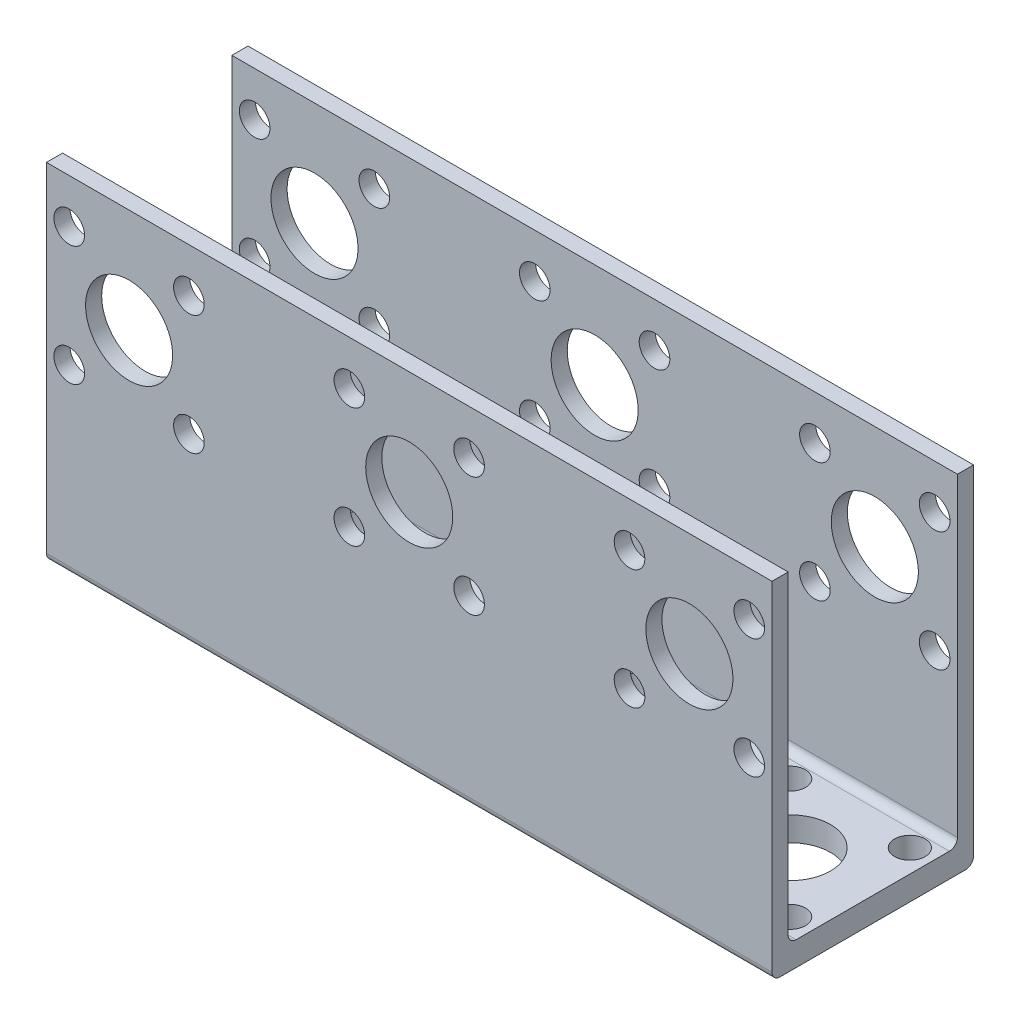
from build123d import *

# Parameters (mm, degrees)
CROQUIS1_W                 = 90
CROQUIS1_H                 = 25
SALIENTE_EXTRUIR1_DEPTH    = 3
CROQUIS2_W                 = 90
CROQUIS2_H                 = 2
SALIENTE_EXTRUIR2_DEPTH    = 40
CROQUIS3_R                 = 5.4
CROQUIS3_R_2               = 1.9
CORTAR_EXTRUIR1_DEPTH      = 68.074585351
MATRIZC1_COUNT             = 4
MATRIZL1_COUNT             = 2
MATRIZL1_PITCH             = 34.75
MATRIZL1_COPY_1_SKETCH_R   = 5.4
MATRIZL1_COPY_1_SKETCH_R_2 = 1.9
MATRIZL1_COPY_1_DEPTH      = 68.074585351
MATRIZL1_COPY_2_SKETCH_R   = 5.4
MATRIZL1_COPY_2_SKETCH_R_2 = 1.9
MATRIZL1_COPY_2_DEPTH      = 68.074585351
MATRIZL1_COPY_3_SKETCH_R   = 5.4
MATRIZL1_COPY_3_SKETCH_R_2 = 1.9
MATRIZL1_COPY_3_DEPTH      = 68.074585351
MATRIZL2_COUNT             = 2
MATRIZL2_PITCH             = 34.75
MATRIZL2_COPY_1_SKETCH_R   = 5.4
MATRIZL2_COPY_1_SKETCH_R_2 = 1.9
MATRIZL2_COPY_1_DEPTH      = 68.074585351
MATRIZL2_COPY_2_SKETCH_R   = 5.4
MATRIZL2_COPY_2_SKETCH_R_2 = 1.9
MATRIZL2_COPY_2_DEPTH      = 68.074585351
MATRIZL2_COPY_3_SKETCH_R   = 5.4
MATRIZL2_COPY_3_SKETCH_R_2 = 1.9
MATRIZL2_COPY_3_DEPTH      = 68.074585351
CROQUIS4_R                 = 5
CROQUIS4_R_2               = 1.9
CORTAR_EXTRUIR2_DEPTH      = 10
MATRIZC2_COUNT             = 4
MATRIZL3_COUNT             = 2
MATRIZL3_PITCH             = 34.75
MATRIZL3_COPY_1_SKETCH_R   = 5
MATRIZL3_COPY_1_SKETCH_R_2 = 1.9
MATRIZL3_COPY_1_DEPTH      = 10
MATRIZL3_COPY_2_SKETCH_R   = 5
MATRIZL3_COPY_2_SKETCH_R_2 = 1.9
MATRIZL3_COPY_2_DEPTH      = 10
MATRIZL3_COPY_3_SKETCH_R   = 5
MATRIZL3_COPY_3_SKETCH_R_2 = 1.9
MATRIZL3_COPY_3_DEPTH      = 10
MATRIZL4_OUTLINE_R         = 5
MATRIZL4_OUTLINE_R_2       = 1.9
MATRIZL4_DEPTH             = 3
REDONDEO1_R                = 1


# Read off the part's stored shape, not the designer's step: MatrizL4
with BuildPart() as part:
    # Croquis1 → Saliente-Extruir1 (new body)
    with BuildSketch(Plane(origin=(0, 0, 0), x_dir=(1, 0, 0), z_dir=(0, 1, 0))):
        Rectangle(CROQUIS1_W, CROQUIS1_H)
    extrude(amount=SALIENTE_EXTRUIR1_DEPTH)

    # Croquis2 → Saliente-Extruir2 (add)
    with BuildSketch(Plane(origin=(0, 3, 0), x_dir=(1, 0, 0), z_dir=(0, 1, 0))):
        with Locations((0, 11.5)):
            Rectangle(CROQUIS2_W, CROQUIS2_H)
        with Locations((0, -11.5)):
            Rectangle(CROQUIS2_W, CROQUIS2_H)
    extrude(amount=SALIENTE_EXTRUIR2_DEPTH)

    # Croquis3 → Cortar-Extruir1 (cut, through all)
    with BuildSketch(Plane(origin=(0, 0, -12.5), x_dir=(-1, 0, 0), z_dir=(0, 0, -1))):
        with Locations((0, 30.08)):
            Circle(CROQUIS3_R)
        with Locations((7.424621202, 37.504621202)):
            Circle(CROQUIS3_R_2)
    cortar_extruir1 = extrude(amount=-CORTAR_EXTRUIR1_DEPTH, mode=Mode.SUBTRACT)

    # MatrizC1: Cortar-Extruir1 ×4 about axis
    matrizc1_axis = Axis((0, 30.08, 0), (0, 0, 1))
    for i in range(1, MATRIZC1_COUNT):
        add(cortar_extruir1.rotate(matrizc1_axis, i * 360 / MATRIZC1_COUNT), mode=Mode.SUBTRACT)

    # MatrizL1: Cortar-Extruir1 ×2
    with Locations(*[(i * MATRIZL1_PITCH, 0, 0) for i in range(1, MATRIZL1_COUNT)]):
        add(cortar_extruir1, mode=Mode.SUBTRACT)

    # MatrizL1 copy 1 sketch → MatrizL1 copy 1 (cut, through all)
    with BuildSketch(Plane(origin=(64.83, 30.08, -12.5), x_dir=(0, -1, 0), z_dir=(0, 0, -1))):
        with Locations((0, 30.08)):
            Circle(MATRIZL1_COPY_1_SKETCH_R)
        with Locations((7.424621202, 37.504621202)):
            Circle(MATRIZL1_COPY_1_SKETCH_R_2)
    extrude(amount=-MATRIZL1_COPY_1_DEPTH, mode=Mode.SUBTRACT)

    # MatrizL1 copy 2 sketch → MatrizL1 copy 2 (cut, through all)
    with BuildSketch(Plane(origin=(34.75, 60.16, -12.5), x_dir=(1, 0, 0), z_dir=(0, 0, -1))):
        with Locations((0, 30.08)):
            Circle(MATRIZL1_COPY_2_SKETCH_R)
        with Locations((7.424621202, 37.504621202)):
            Circle(MATRIZL1_COPY_2_SKETCH_R_2)
    extrude(amount=-MATRIZL1_COPY_2_DEPTH, mode=Mode.SUBTRACT)

    # MatrizL1 copy 3 sketch → MatrizL1 copy 3 (cut, through all)
    with BuildSketch(Plane(origin=(4.67, 30.08, -12.5), x_dir=(0, 1, 0), z_dir=(0, 0, -1))):
        with Locations((0, 30.08)):
            Circle(MATRIZL1_COPY_3_SKETCH_R)
        with Locations((7.424621202, 37.504621202)):
            Circle(MATRIZL1_COPY_3_SKETCH_R_2)
    extrude(amount=-MATRIZL1_COPY_3_DEPTH, mode=Mode.SUBTRACT)

    # MatrizL2: Cortar-Extruir1 ×2
    with Locations(*[(-i * MATRIZL2_PITCH, 0, 0) for i in range(1, MATRIZL2_COUNT)]):
        add(cortar_extruir1, mode=Mode.SUBTRACT)

    # MatrizL2 copy 1 sketch → MatrizL2 copy 1 (cut, through all)
    with BuildSketch(Plane(origin=(-4.67, 30.08, -12.5), x_dir=(0, -1, 0), z_dir=(0, 0, -1))):
        with Locations((0, 30.08)):
            Circle(MATRIZL2_COPY_1_SKETCH_R)
        with Locations((7.424621202, 37.504621202)):
            Circle(MATRIZL2_COPY_1_SKETCH_R_2)
    extrude(amount=-MATRIZL2_COPY_1_DEPTH, mode=Mode.SUBTRACT)

    # MatrizL2 copy 2 sketch → MatrizL2 copy 2 (cut, through all)
    with BuildSketch(Plane(origin=(-34.75, 60.16, -12.5), x_dir=(1, 0, 0), z_dir=(0, 0, -1))):
        with Locations((0, 30.08)):
            Circle(MATRIZL2_COPY_2_SKETCH_R)
        with Locations((7.424621202, 37.504621202)):
            Circle(MATRIZL2_COPY_2_SKETCH_R_2)
    extrude(amount=-MATRIZL2_COPY_2_DEPTH, mode=Mode.SUBTRACT)

    # MatrizL2 copy 3 sketch → MatrizL2 copy 3 (cut, through all)
    with BuildSketch(Plane(origin=(-64.83, 30.08, -12.5), x_dir=(0, 1, 0), z_dir=(0, 0, -1))):
        with Locations((0, 30.08)):
            Circle(MATRIZL2_COPY_3_SKETCH_R)
        with Locations((7.424621202, 37.504621202)):
            Circle(MATRIZL2_COPY_3_SKETCH_R_2)
    extrude(amount=-MATRIZL2_COPY_3_DEPTH, mode=Mode.SUBTRACT)

    # Croquis4 → Cortar-Extruir2 (cut)
    with BuildSketch(Plane.XZ):
        with Locations(Location((0, 0, 0), (0, 0, 270))):
            Circle(CROQUIS4_R)
        with Locations(Location((-7.424621202, -7.424621202, 0), (0, 0, 270))):
            Circle(CROQUIS4_R_2)
    cortar_extruir2 = extrude(amount=-CORTAR_EXTRUIR2_DEPTH, mode=Mode.SUBTRACT)

    # MatrizC2: Cortar-Extruir2 ×4 about axis
    matrizc2_axis = Axis((0, 0, 0), (0, 1, 0))
    for i in range(1, MATRIZC2_COUNT):
        add(cortar_extruir2.rotate(matrizc2_axis, i * 360 / MATRIZC2_COUNT), mode=Mode.SUBTRACT)

    # MatrizL3: Cortar-Extruir2 ×2
    with Locations(*[(i * MATRIZL3_PITCH, 0, 0) for i in range(1, MATRIZL3_COUNT)]):
        add(cortar_extruir2, mode=Mode.SUBTRACT)

    # MatrizL3 copy 1 sketch → MatrizL3 copy 1 (cut)
    with BuildSketch(Plane(origin=(34.75, 0, 0), x_dir=(0, 0, -1), z_dir=(0, -1, 0))):
        with Locations(Location((0, 0, 0), (0, 0, 270))):
            Circle(MATRIZL3_COPY_1_SKETCH_R)
        with Locations(Location((-7.424621202, -7.424621202, 0), (0, 0, 270))):
            Circle(MATRIZL3_COPY_1_SKETCH_R_2)
    extrude(amount=-MATRIZL3_COPY_1_DEPTH, mode=Mode.SUBTRACT)

    # MatrizL3 copy 2 sketch → MatrizL3 copy 2 (cut)
    with BuildSketch(Plane(origin=(34.75, 0, 0), x_dir=(-1, 0, 0), z_dir=(0, -1, 0))):
        with Locations(Location((0, 0, 0), (0, 0, 270))):
            Circle(MATRIZL3_COPY_2_SKETCH_R)
        with Locations(Location((-7.424621202, -7.424621202, 0), (0, 0, 270))):
            Circle(MATRIZL3_COPY_2_SKETCH_R_2)
    extrude(amount=-MATRIZL3_COPY_2_DEPTH, mode=Mode.SUBTRACT)

    # MatrizL3 copy 3 sketch → MatrizL3 copy 3 (cut)
    with BuildSketch(Plane(origin=(34.75, 0, 0), x_dir=(0, 0, 1), z_dir=(0, -1, 0))):
        with Locations(Location((0, 0, 0), (0, 0, 270))):
            Circle(MATRIZL3_COPY_3_SKETCH_R)
        with Locations(Location((-7.424621202, -7.424621202, 0), (0, 0, 270))):
            Circle(MATRIZL3_COPY_3_SKETCH_R_2)
    extrude(amount=-MATRIZL3_COPY_3_DEPTH, mode=Mode.SUBTRACT)

    # MatrizL4 outline → MatrizL4 (cut)
    with BuildSketch(Plane(origin=(0, 0, 0), x_dir=(1, 0, 0), z_dir=(0, 1, 0))):
        with Locations((-34.75, 0)):
            Circle(MATRIZL4_OUTLINE_R)
        with Locations((-42.174621202, 7.424621202)):
            Circle(MATRIZL4_OUTLINE_R_2)
        with Locations((-27.325378798, 7.424621202)):
            Circle(MATRIZL4_OUTLINE_R_2)
        with Locations((-27.325378798, -7.424621202)):
            Circle(MATRIZL4_OUTLINE_R_2)
        with Locations((-42.174621202, -7.424621202)):
            Circle(MATRIZL4_OUTLINE_R_2)
    extrude(amount=MATRIZL4_DEPTH, mode=Mode.SUBTRACT)

    # Redondeo1
    redondeo1_edges = [part.edges().sort_by_distance(p)[0] for p in [
        (0, 3, 10.5),
        (0, 3, -10.5),
        (0, 0, -12.5),
        (0, 0, 12.5),
    ]]
    fillet(redondeo1_edges, radius=REDONDEO1_R)


solid = part.part
